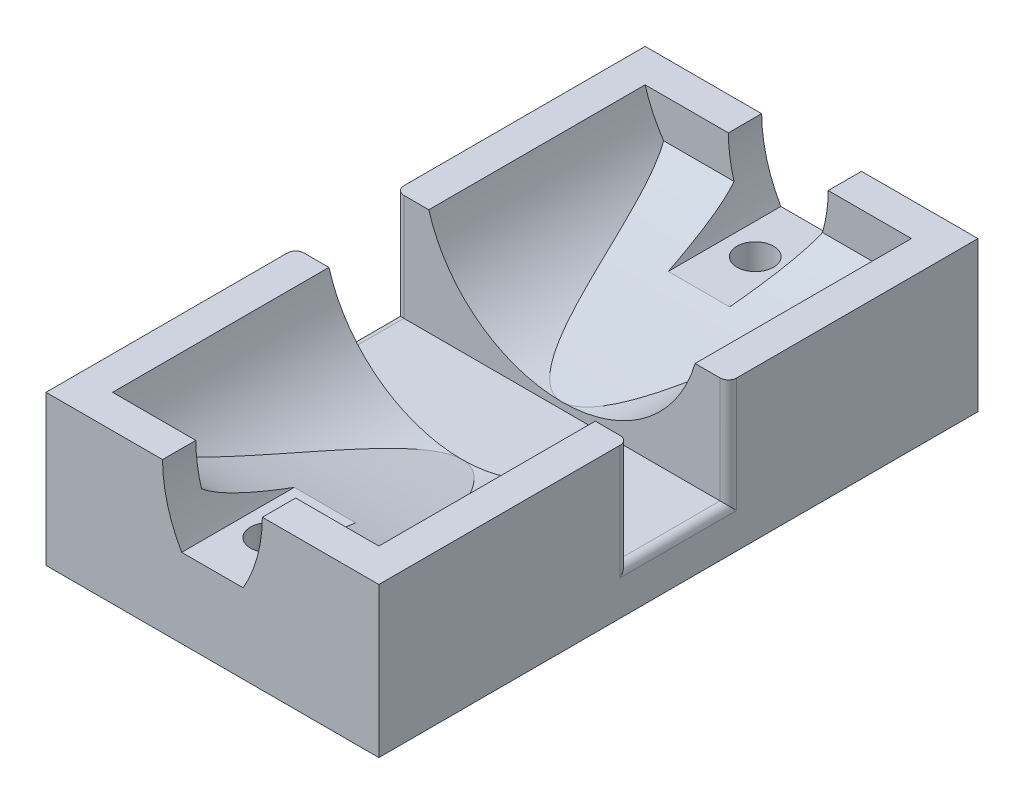
from build123d import *

# Parameters (mm, degrees)
BOSS_EXTRUDE1_DEPTH     = 15.045877519
BOSS_EXTRUDE2_DEPTH     = 30
BOSS_EXTRUDE3_DEPTH     = 160
CUT_EXTRUDE1_DEPTH      = 397.42670329
CUT_EXTRUDE1_DEPTH_BACK = 397.42670329
SKETCH5_W               = 30
SKETCH5_H               = 30
CUT_EXTRUDE2_START      = -30
CUT_EXTRUDE2_DEPTH      = 30
CUT_EXTRUDE3_DEPTH      = 2.010455065
BOSS_EXTRUDE6_START     = -34.448076
BOSS_EXTRUDE6_DEPTH     = 68.896152
SKETCH13_W              = 15
SKETCH13_H              = 30
BOSS_EXTRUDE7_DEPTH     = 10
SKETCH14_W              = 15
SKETCH14_H              = 30
BOSS_EXTRUDE8_DEPTH     = 10
CUT_EXTRUDE6_DEPTH      = 192
SKETCH18_R              = 3
CUT_EXTRUDE7_DEPTH      = 192
CUT_EXTRUDE8_REACH      = 232.854
SKETCH19_R              = 5.5
FILLET2_R               = 2.5


# Read off the part's stored shape, not the designer's step: Boss-Extrude3
with BuildPart() as part:
    # Sketch1 → Boss-Extrude1 (new body)
    with BuildSketch(Plane(origin=(0, 0, 0), x_dir=(1, 0, 0), z_dir=(0, 1, 0))):
        with BuildLine():
            Line((-185, -65), (5, -65))
            ThreePointArc((5, -65), (60.514401442, -84.704810384), (91.182336182, -135))
            Line((91.182336182, -135), (185, -135))
            Line((185, -135), (185, 135))
            Line((185, 135), (-185, 135))
            Line((-185, 135), (-185, -65))
        make_face()
    extrude(amount=BOSS_EXTRUDE1_DEPTH)

    # Sketch2 → Boss-Extrude2 (add)
    with BuildSketch(Plane(origin=(0, 15.045877519, 0), x_dir=(1, 0, 0), z_dir=(0, 1, 0))):
        Polygon((-175, -35), (-175, 30), (-185, 30), (-185, -45), (-142.5, -45), (-142.5, -35), align=None)
        Polygon((-175, 125), (-142.5, 125), (-142.5, 135), (-185, 135), (-185, 60), (-175, 60), align=None)
        Polygon((-95, -35), (-95, 30), (-85, 30), (-85, -45), (-127.5, -45), (-127.5, -35), align=None)
        Polygon((-127.5, 135), (-127.5, 125), (-95, 125), (-95, 60), (-85, 60), (-85, 135), align=None)
    extrude(amount=BOSS_EXTRUDE2_DEPTH)

    # Boss-Extrude3 outline → Boss-Extrude3 (add)
    with BuildSketch(Plane.XY.offset(-125)):
        with BuildLine():
            ThreePointArc((-95, 45.045877519), (-110, 23.379210852), (-135, 15.045877519))
            Line((-135, 15.045877519), (-95, 15.045877519))
            Line((-95, 15.045877519), (-95, 45.045877519))
        make_face()
        with BuildLine():
            Line((-175, 45.045877519), (-175, 15.045877519))
            Line((-175, 15.045877519), (-135, 15.045877519))
            ThreePointArc((-135, 15.045877519), (-160, 23.379210852), (-175, 45.045877519))
        make_face()
    extrude(amount=BOSS_EXTRUDE3_DEPTH)

    # Sketch5 → Cut-Extrude1 (cut, two sides: drawn at the far end of the back side and taken through both)
    with BuildSketch(Plane.ZY.offset(185).offset(-CUT_EXTRUDE1_DEPTH_BACK)):
        with Locations((-45, 30.045877519)):
            Rectangle(SKETCH5_W, SKETCH5_H)
    extrude(amount=CUT_EXTRUDE1_DEPTH + CUT_EXTRUDE1_DEPTH_BACK, mode=Mode.SUBTRACT)

    # Sketch6 → Cut-Extrude2 (cut)
    with BuildSketch(Plane(origin=(0, 15.045877519, 0), x_dir=(1, 0, 0), z_dir=(0, 1, 0)).offset(CUT_EXTRUDE2_START)):
        with BuildLine():
            Line((-85, 135), (-85, 60))
            Line((-85, 60), (-85, 30))
            Line((-85, 30), (-85, -45))
            Line((-85, -45), (-127.5, -45))
            Line((-127.5, -45), (-142.5, -45))
            Line((-142.5, -45), (-185, -45))
            Line((-185, -45), (-185, -65))
            Line((-185, -65), (5, -65))
            ThreePointArc((5, -65), (60.514401442, -84.704810384), (91.182336182, -135))
            Line((91.182336182, -135), (185, -135))
            Line((185, -135), (185, 135))
            Line((185, 135), (-85, 135))
        make_face()
    extrude(amount=CUT_EXTRUDE2_DEPTH, mode=Mode.SUBTRACT)

    # Sketch8 → Cut-Extrude3 (cut)
    with BuildSketch(Plane(origin=(0, 15.045877519, 0), x_dir=(1, 0, 0), z_dir=(0, 1, 0))):
        Polygon((-135, 60), (-185, 60), (-185, 30), (-135, 30), (-85, 30), (-85, 60), align=None)
    extrude(amount=-CUT_EXTRUDE3_DEPTH, mode=Mode.SUBTRACT)

    # Sketch12 → Boss-Extrude6 (add)
    with BuildSketch(Plane(origin=(-135, 0, 0), x_dir=(0, 0, -1), z_dir=(1, 0, 0)).offset(BOSS_EXTRUDE6_START)):
        with BuildLine():
            Line((-35, 33.272382456), (-35, 15.00790917))
            Line((-35, 15.00790917), (30, 15.045877519))
            add(Edge.make_bspline(
                [(-35, 33.272382456), (-23.622698209, 24.45769668), (30, 15.045877519)],
                knots=[0, 0, 0, 1, 1, 1], degree=2))
        make_face()
    boss_extrude6 = extrude(amount=BOSS_EXTRUDE6_DEPTH)

    # Sketch13 → Boss-Extrude7 (add)
    with BuildSketch(Plane.XY.offset(45)):
        with Locations((-135, 30.045877519)):
            Rectangle(SKETCH13_W, SKETCH13_H)
    extrude(amount=-BOSS_EXTRUDE7_DEPTH)

    # Sketch14 → Boss-Extrude8 (add)
    with BuildSketch(Plane(origin=(0, 0, -135), x_dir=(-1, 0, 0), z_dir=(0, 0, -1))):
        with Locations((135, 30.045877519)):
            Rectangle(SKETCH14_W, SKETCH14_H)
    extrude(amount=-BOSS_EXTRUDE8_DEPTH)

    # Mirror3: Boss-Extrude6 across plane
    add(boss_extrude6.mirror(Plane.XY.offset(-45)))

    # Sketch9 → Cut-Extrude6 (cut)
    with BuildSketch(Plane.XY.offset(45)):
        with BuildLine():
            Line((-150, 45.045877519), (-120, 45.045877519))
            ThreePointArc((-120, 45.045877519), (-121.500780237, 34.041891851), (-125.767198961, 23.788223571))
            Line((-125.767198961, 23.788223571), (-144.232801039, 23.788223571))
            ThreePointArc((-144.232801039, 23.788223571), (-148.499219763, 34.041891851), (-150, 45.045877519))
        make_face()
    extrude(amount=-CUT_EXTRUDE6_DEPTH, mode=Mode.SUBTRACT)

    # Sketch18 → Cut-Extrude7 (cut)
    with BuildSketch(Plane.XZ):
        with Locations(Location((-135, 28.073614807, 0), (0, 0, 270))):
            Circle(SKETCH18_R)
    cut_extrude7 = extrude(amount=-CUT_EXTRUDE7_DEPTH, mode=Mode.SUBTRACT)

    # Sketch19 → Cut-Extrude8 (cut, up to next)
    with BuildSketch(Plane(origin=(0, 16, 0), x_dir=(-1, 0, 0), z_dir=(0, -1, 0)), mode=Mode.PRIVATE) as cut_extrude8_sk1:
        with Locations(Location((135, -28.073614807, 0), (0, 0, 90))):
            Circle(SKETCH19_R)
    cut_extrude8_tool1 = extrude(cut_extrude8_sk1.sketch, amount=-CUT_EXTRUDE8_REACH, mode=Mode.PRIVATE) & part.part
    cut_extrude8 = cut_extrude8_tool1.solids().sort_by_distance((-135, 16, 28.073615))[0]
    add(cut_extrude8, mode=Mode.SUBTRACT)

    # Mirror4: Cut-Extrude7, Cut-Extrude8 across plane
    add(cut_extrude7.mirror(Plane.XY.offset(-45)), mode=Mode.SUBTRACT)
    add(cut_extrude8.mirror(Plane.XY.offset(-45)), mode=Mode.SUBTRACT)

    # Fillet2
    fillet2_edges = [part.edges().sort_by_distance(p)[0] for p in [
        (-85, 13.035422455, -45),
        (-185, 13.035422455, -45),
        (-185, 29.040649987, -30),
        (-185, 29.040649987, -60),
        (-85, 29.040649987, -60),
        (-85, 29.040649987, -30),
    ]]
    fillet(fillet2_edges, radius=FILLET2_R)


solid = part.part
